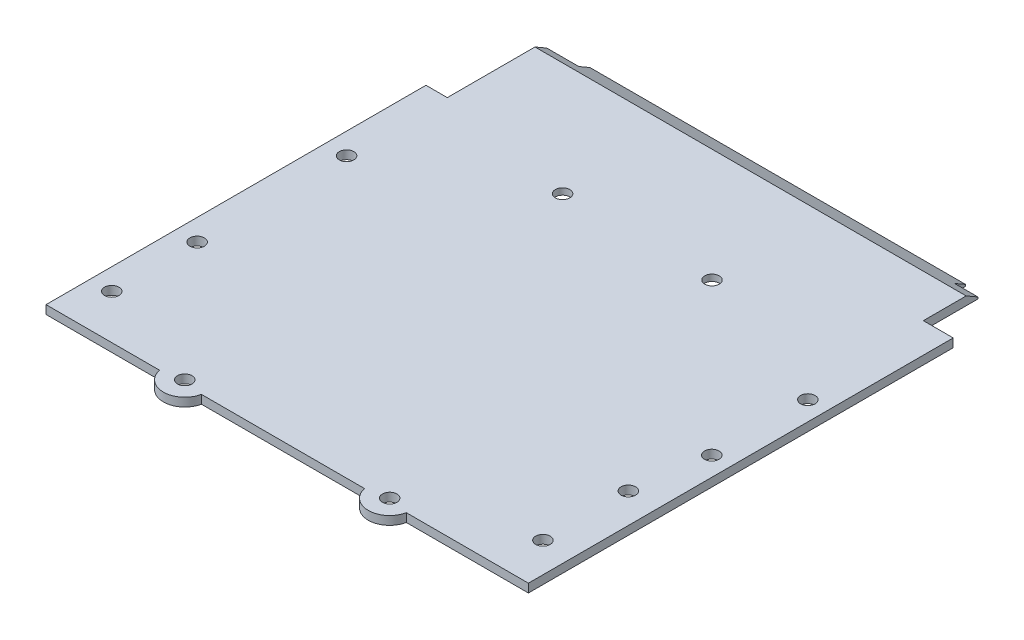
from build123d import *

# Parameters (mm, degrees)
SKETCH_1_W           = 113
SKETCH_1_H           = 113
EXTRUDE_1_DEPTH      = 3
CUT_EXTRUDE_1_REACH  = 161.834
SKETCH_2_R           = 1.7
SKETCH_3_W           = 90
SKETCH_3_H           = 105
EXTRUDE_2_DEPTH      = 1.5
SKETCH_5_R           = 5
EXTRUDE_3_DEPTH      = 3
CUT_EXTRUDE_2_REACH  = 161.834
SKETCH_6_R           = 1.7
CUT_EXTRUDE_3_REACH  = 161.834
SKETCH_7_R           = 1.7
CUT_EXTRUDE_4_REACH  = 161.869
SKETCH_8_R           = 1.7
EXTRUDE_5_DEPTH      = 90
CUT_EXTRUDE_5_DEPTH  = 2
SKETCH_13_W          = 2
SKETCH_13_H          = 12
EXTRUDE_6_DEPTH      = 11.5
CUT_EXTRUDE_6_REACH  = 161.985
SKETCH_14_R          = 1.7
CUT_EXTRUDE_7_REACH  = 164.062
EXTRUDE_7_DEPTH      = 8.5
SKETCH_17_W          = 2
SKETCH_17_H          = 11.5
EXTRUDE_8_DEPTH      = 3
FILLET_1_R           = 1
CUT_EXTRUDE_8_DEPTH  = 163.062226394
SKETCH_20_W          = 113
SKETCH_20_H          = 12.124355653
CUT_EXTRUDE_9_DEPTH  = 1
CHAMFER_1_SIZE       = 1
SKETCH_21_W          = 7
SKETCH_21_H          = 13.5
CUT_EXTRUDE_10_DEPTH = 163.062226394
SKETCH_22_W          = 5
SKETCH_22_H          = 24
CUT_EXTRUDE_11_DEPTH = 163.062226394
SKETCH_23_W          = 2
SKETCH_23_H          = 18.598076211
CUT_EXTRUDE_12_DEPTH = 1.5
CHAMFER_2_SIZE       = 2
SKETCH_24_W          = 0.692820323
SKETCH_24_H          = 0.4
CUT_EXTRUDE_13_DEPTH = 95.5
SKETCH_25_W          = 0.692820323
SKETCH_25_H          = 0.4
CUT_EXTRUDE_14_DEPTH = 5.5
SKETCH_26_W          = 0.692820323
SKETCH_26_H          = 0.4
CUT_EXTRUDE_15_DEPTH = 7.5
SKETCH_27_W          = 113
SKETCH_27_H          = 105.875644347
CUT_EXTRUDE_16_DEPTH = 162.723430061
SKETCH_29_W          = 10
SKETCH_29_H          = 5
CUT_EXTRUDE_17_DEPTH = 162.605129345
SKETCH_30_W          = 10
SKETCH_30_H          = 2
CUT_EXTRUDE_18_DEPTH = 37
SKETCH_31_W          = 10
SKETCH_31_H          = 27
EXTRUDE_9_DEPTH      = 1
CUT_EXTRUDE_19_REACH = 163.569
SKETCH_32_W          = 5
SKETCH_32_H          = 12


with BuildPart() as part:
    # 草图1 → 凸台-拉伸1 (new body)
    with BuildSketch(Plane(origin=(0, 0, 0), x_dir=(1, 0, 0), z_dir=(0, 1, 0))):
        with Locations((56.5, 56.5)):
            Rectangle(SKETCH_1_W, SKETCH_1_H)
    extrude(amount=EXTRUDE_1_DEPTH)

    # 草图2 → 切除-拉伸1 (cut, up to next)
    with BuildSketch(Plane(origin=(0, 3, 0), x_dir=(1, 0, 0), z_dir=(0, 1, 0)), mode=Mode.PRIVATE) as cut_extrude_1_sk1:
        with Locations(Location((108.5, 69.95, 0), (0, 0, 270))):
            Circle(SKETCH_2_R)
    cut_extrude_1_tool1 = extrude(cut_extrude_1_sk1.sketch, amount=-CUT_EXTRUDE_1_REACH, mode=Mode.PRIVATE) & part.part
    # 草图2 → 切除-拉伸1 (cut, up to next)
    with BuildSketch(Plane(origin=(0, 3, 0), x_dir=(1, 0, 0), z_dir=(0, 1, 0)), mode=Mode.PRIVATE) as cut_extrude_1_sk2:
        with Locations(Location((108.5, 47.45, 0), (0, 0, 270))):
            Circle(SKETCH_2_R)
    cut_extrude_1_tool2 = extrude(cut_extrude_1_sk2.sketch, amount=-CUT_EXTRUDE_1_REACH, mode=Mode.PRIVATE) & part.part
    # 草图2 → 切除-拉伸1 (cut, up to next)
    with BuildSketch(Plane(origin=(0, 3, 0), x_dir=(1, 0, 0), z_dir=(0, 1, 0)), mode=Mode.PRIVATE) as cut_extrude_1_sk3:
        with Locations(Location((106, 30.4, 0), (0, 0, 270))):
            Circle(SKETCH_2_R)
    cut_extrude_1_tool3 = extrude(cut_extrude_1_sk3.sketch, amount=-CUT_EXTRUDE_1_REACH, mode=Mode.PRIVATE) & part.part
    # 草图2 → 切除-拉伸1 (cut, up to next)
    with BuildSketch(Plane(origin=(0, 3, 0), x_dir=(1, 0, 0), z_dir=(0, 1, 0)), mode=Mode.PRIVATE) as cut_extrude_1_sk4:
        with Locations(Location((106, 10.4, 0), (0, 0, 270))):
            Circle(SKETCH_2_R)
    cut_extrude_1_tool4 = extrude(cut_extrude_1_sk4.sketch, amount=-CUT_EXTRUDE_1_REACH, mode=Mode.PRIVATE) & part.part
    add(cut_extrude_1_tool1.solids().sort_by_distance((108.5, 3, -69.95))[0], mode=Mode.SUBTRACT)
    add(cut_extrude_1_tool2.solids().sort_by_distance((108.5, 3, -47.45))[0], mode=Mode.SUBTRACT)
    add(cut_extrude_1_tool3.solids().sort_by_distance((106, 3, -30.4))[0], mode=Mode.SUBTRACT)
    add(cut_extrude_1_tool4.solids().sort_by_distance((106, 3, -10.4))[0], mode=Mode.SUBTRACT)

    # 草图3 → 凸台-拉伸2 (add)
    with BuildSketch(Plane(origin=(0, 0, 0), x_dir=(1, 0, 0), z_dir=(0, 1, 0))):
        with Locations((55.5, 60.5)):
            Rectangle(SKETCH_3_W, SKETCH_3_H)
    extrude(amount=-EXTRUDE_2_DEPTH)

    # 草图5 → 凸台-拉伸3 (add)
    with BuildSketch(Plane.XZ):
        with Locations((79.5, -1)):
            Circle(SKETCH_5_R)
        with Locations((31.5, -1)):
            Circle(SKETCH_5_R)
    extrude(amount=-EXTRUDE_3_DEPTH)

    # 草图6 → 切除-拉伸2 (cut, up to next)
    with BuildSketch(Plane.XZ, mode=Mode.PRIVATE) as cut_extrude_2_sk1:
        with Locations(Location((31.5, -1, 0), (0, 0, 270))):
            Circle(SKETCH_6_R)
    cut_extrude_2_tool1 = extrude(cut_extrude_2_sk1.sketch, amount=-CUT_EXTRUDE_2_REACH, mode=Mode.PRIVATE) & part.part
    # 草图6 → 切除-拉伸2 (cut, up to next)
    with BuildSketch(Plane.XZ, mode=Mode.PRIVATE) as cut_extrude_2_sk2:
        with Locations(Location((79.5, -1, 0), (0, 0, 270))):
            Circle(SKETCH_6_R)
    cut_extrude_2_tool2 = extrude(cut_extrude_2_sk2.sketch, amount=-CUT_EXTRUDE_2_REACH, mode=Mode.PRIVATE) & part.part
    add(cut_extrude_2_tool1.solids().sort_by_distance((31.5, 0, -1))[0], mode=Mode.SUBTRACT)
    add(cut_extrude_2_tool2.solids().sort_by_distance((79.5, 0, -1))[0], mode=Mode.SUBTRACT)

    # 草图7 → 切除-拉伸3 (cut, up to next)
    with BuildSketch(Plane.XZ, mode=Mode.PRIVATE) as cut_extrude_3_sk1:
        with Locations(Location((5, -10.4, 0), (0, 0, 270))):
            Circle(SKETCH_7_R)
    cut_extrude_3_tool1 = extrude(cut_extrude_3_sk1.sketch, amount=-CUT_EXTRUDE_3_REACH, mode=Mode.PRIVATE) & part.part
    # 草图7 → 切除-拉伸3 (cut, up to next)
    with BuildSketch(Plane.XZ, mode=Mode.PRIVATE) as cut_extrude_3_sk2:
        with Locations(Location((5, -30.4, 0), (0, 0, 270))):
            Circle(SKETCH_7_R)
    cut_extrude_3_tool2 = extrude(cut_extrude_3_sk2.sketch, amount=-CUT_EXTRUDE_3_REACH, mode=Mode.PRIVATE) & part.part
    # 草图7 → 切除-拉伸3 (cut, up to next)
    with BuildSketch(Plane.XZ, mode=Mode.PRIVATE) as cut_extrude_3_sk3:
        with Locations(Location((5, -65.4, 0), (0, 0, 270))):
            Circle(SKETCH_7_R)
    cut_extrude_3_tool3 = extrude(cut_extrude_3_sk3.sketch, amount=-CUT_EXTRUDE_3_REACH, mode=Mode.PRIVATE) & part.part
    add(cut_extrude_3_tool1.solids().sort_by_distance((5, 0, -10.4))[0], mode=Mode.SUBTRACT)
    add(cut_extrude_3_tool2.solids().sort_by_distance((5, 0, -30.4))[0], mode=Mode.SUBTRACT)
    add(cut_extrude_3_tool3.solids().sort_by_distance((5, 0, -65.4))[0], mode=Mode.SUBTRACT)

    # 草图8 → 切除-拉伸4 (cut, up to next)
    with BuildSketch(Plane.XZ.offset(1.5), mode=Mode.PRIVATE) as cut_extrude_4_sk1:
        with Locations(Location((38, -83, 0), (0, 0, 270))):
            Circle(SKETCH_8_R)
    cut_extrude_4_tool1 = extrude(cut_extrude_4_sk1.sketch, amount=-CUT_EXTRUDE_4_REACH, mode=Mode.PRIVATE) & part.part
    # 草图8 → 切除-拉伸4 (cut, up to next)
    with BuildSketch(Plane.XZ.offset(1.5), mode=Mode.PRIVATE) as cut_extrude_4_sk2:
        with Locations(Location((73, -83, 0), (0, 0, 270))):
            Circle(SKETCH_8_R)
    cut_extrude_4_tool2 = extrude(cut_extrude_4_sk2.sketch, amount=-CUT_EXTRUDE_4_REACH, mode=Mode.PRIVATE) & part.part
    add(cut_extrude_4_tool1.solids().sort_by_distance((38, -1.5, -83))[0], mode=Mode.SUBTRACT)
    add(cut_extrude_4_tool2.solids().sort_by_distance((73, -1.5, -83))[0], mode=Mode.SUBTRACT)

    # 草图10 → 凸台-拉伸5 (add)
    with BuildSketch(Plane(origin=(100.5, 0, 0), x_dir=(0, 0, -1), z_dir=(1, 0, 0))):
        Polygon((113, 0), (115.598076211, -1.5), (113, -1.5), align=None)
    extrude(amount=-EXTRUDE_5_DEPTH)

    # 草图11 → 切除-拉伸5 (cut)
    with BuildSketch(Plane(origin=(0, -1.5, 0), x_dir=(1, 0, 0), z_dir=(0, 1, 0))):
        with BuildLine():
            Line((33, 83), (33, 53))
            ThreePointArc((33, 53), (38, 48), (43, 53))
            Line((43, 53), (43, 83))
            ThreePointArc((43, 83), (38, 88), (33, 83))
        make_face()
        with BuildLine():
            Line((68, 83), (68, 53))
            ThreePointArc((68, 53), (73, 48), (78, 53))
            Line((78, 53), (78, 83))
            ThreePointArc((78, 83), (73, 88), (68, 83))
        make_face()
    extrude(amount=CUT_EXTRUDE_5_DEPTH, mode=Mode.SUBTRACT)

    # 草图13 → 凸台-拉伸6 (add)
    with BuildSketch(Plane.XZ):
        with Locations((4, -83)):
            Rectangle(SKETCH_13_W, SKETCH_13_H)
    extrude(amount=EXTRUDE_6_DEPTH)

    # 草图14 → 切除-拉伸6 (cut, up to next)
    with BuildSketch(Plane.ZY.offset(-3), mode=Mode.PRIVATE) as cut_extrude_6_sk1:
        with Locations((-83.5, -5)):
            Circle(SKETCH_14_R)
    cut_extrude_6_tool1 = extrude(cut_extrude_6_sk1.sketch, amount=-CUT_EXTRUDE_6_REACH, mode=Mode.PRIVATE) & part.part
    add(cut_extrude_6_tool1.solids().sort_by_distance((3, -5, -83.5))[0], mode=Mode.SUBTRACT)

    # 草图15 → 切除-拉伸7 (cut, up to next)
    with BuildSketch(Plane.XZ, mode=Mode.PRIVATE) as cut_extrude_7_sk1:
        Polygon((113, -100.875644347), (106, -113), (113, -113), align=None)
    cut_extrude_7_tool1 = extrude(cut_extrude_7_sk1.sketch, amount=-CUT_EXTRUDE_7_REACH, mode=Mode.PRIVATE) & part.part
    add(cut_extrude_7_tool1.solids().sort_by_distance((110.666667, 0, -108.958548))[0], mode=Mode.SUBTRACT)

    # 草图16 → 凸台-拉伸7 (add)
    with BuildSketch(Plane.XZ):
        Polygon((113, -99.5), (107.5, -99.5), (107.5, -110.401923789), (113, -100.875644347), align=None)
    extrude(amount=EXTRUDE_7_DEPTH)

    # 草图17 → 凸台-拉伸8 (add)
    with BuildSketch(Plane.ZY.offset(-3)):
        with Locations((-78, -5.75)):
            Rectangle(SKETCH_17_W, SKETCH_17_H)
    extrude(amount=EXTRUDE_8_DEPTH)

    # 圆角1
    fillet_1_edges = [part.edges().sort_by_distance(p)[0] for p in [
        (3, -5.75, -79),
    ]]
    fillet(fillet_1_edges, radius=FILLET_1_R)

    # 草图19 → 切除-拉伸8 (cut, through all)
    with BuildSketch(Plane.ZY):
        Polygon((-113, 0), (-107.803847577, 3), (-113, 3), align=None)
    extrude(amount=-CUT_EXTRUDE_8_DEPTH, mode=Mode.SUBTRACT)

    # 草图20 → 切除-拉伸9 (cut)
    with BuildSketch(Plane(origin=(0, 3, 0), x_dir=(1, 0, 0), z_dir=(0, 1, 0))):
        with Locations((56.5, 106.937822173)):
            Rectangle(SKETCH_20_W, SKETCH_20_H)
    extrude(amount=-CUT_EXTRUDE_9_DEPTH, mode=Mode.SUBTRACT)

    # 倒角1
    chamfer_1_edges = [part.edges().sort_by_distance(p)[0] for p in [
        (56.5, 2, -100.875644347),
    ]]
    chamfer(chamfer_1_edges, length=CHAMFER_1_SIZE - 0.0001)  # a hair under: the kernel refuses the full size

    # 草图21 → 切除-拉伸10 (cut, through all)
    with BuildSketch(Plane.XZ.offset(8.5)):
        with Locations((109.5, -106.25)):
            Rectangle(SKETCH_21_W, SKETCH_21_H)
    extrude(amount=-CUT_EXTRUDE_10_DEPTH, mode=Mode.SUBTRACT)

    # 草图22 → 切除-拉伸11 (cut, through all)
    with BuildSketch(Plane.XZ):
        with Locations((2.5, -101)):
            Rectangle(SKETCH_22_W, SKETCH_22_H)
    extrude(amount=-CUT_EXTRUDE_11_DEPTH, mode=Mode.SUBTRACT)

    # 草图23 → 切除-拉伸12 (cut)
    with BuildSketch(Plane.XZ.offset(1.5)):
        with Locations((11.5, -106.299038106)):
            Rectangle(SKETCH_23_W, SKETCH_23_H)
    extrude(amount=-CUT_EXTRUDE_12_DEPTH, mode=Mode.SUBTRACT)

    # 倒角2
    chamfer_2_edges = [part.edges().sort_by_distance(p)[0] for p in [
        (10.5, -0.75, -97),
    ]]
    chamfer(chamfer_2_edges, length=CHAMFER_2_SIZE - 0.0001)  # a hair under: the kernel refuses the full size

    # 草图24 → 切除-拉伸13 (cut)
    with BuildSketch(Plane(origin=(100.5, 0, 0), x_dir=(0, 0, -1), z_dir=(1, 0, 0))):
        with Locations((115.25166605, -1.3)):
            Rectangle(SKETCH_24_W, SKETCH_24_H)
    extrude(amount=-CUT_EXTRUDE_13_DEPTH, mode=Mode.SUBTRACT)

    # 草图25 → 切除-拉伸14 (cut)
    with BuildSketch(Plane(origin=(106, 0, 0), x_dir=(0, 0, -1), z_dir=(1, 0, 0))):
        with Locations((112.653589839, 0.2)):
            Rectangle(SKETCH_25_W, SKETCH_25_H)
    extrude(amount=-CUT_EXTRUDE_14_DEPTH, mode=Mode.SUBTRACT)

    # 草图26 → 切除-拉伸15 (cut)
    with BuildSketch(Plane.ZY.offset(-5)):
        with Locations((-112.653589839, 0.2)):
            Rectangle(SKETCH_26_W, SKETCH_26_H)
    extrude(amount=-CUT_EXTRUDE_15_DEPTH, mode=Mode.SUBTRACT)

    # 草图27 → 切除-拉伸16 (cut, through all)
    with BuildSketch(Plane(origin=(0, 2, 0), x_dir=(1, 0, 0), z_dir=(0, 1, 0))):
        with Locations((56.5, 48.937822174)):
            Rectangle(SKETCH_27_W, SKETCH_27_H)
    extrude(amount=CUT_EXTRUDE_16_DEPTH, mode=Mode.SUBTRACT)

    # 草图29 → 切除-拉伸17 (cut, through all)
    with BuildSketch(Plane.XZ.offset(-0.5)):
        with Locations((38, -50.5)):
            Rectangle(SKETCH_29_W, SKETCH_29_H)
        with Locations((73, -50.5)):
            Rectangle(SKETCH_29_W, SKETCH_29_H)
    extrude(amount=CUT_EXTRUDE_17_DEPTH, mode=Mode.SUBTRACT)

    # 草图30 → 切除-拉伸18 (cut)
    with BuildSketch(Plane(origin=(0, 0, -48), x_dir=(-1, 0, 0), z_dir=(0, 0, -1))):
        with Locations((-38, -0.5)):
            Rectangle(SKETCH_30_W, SKETCH_30_H)
        with Locations((-73, -0.5)):
            Rectangle(SKETCH_30_W, SKETCH_30_H)
    extrude(amount=-CUT_EXTRUDE_18_DEPTH, mode=Mode.SUBTRACT)

    # 草图31 → 凸台-拉伸9 (add)
    with BuildSketch(Plane.XZ.offset(-0.5)):
        with Locations((38, -24.5)):
            Rectangle(SKETCH_31_W, SKETCH_31_H)
        with Locations((73, -24.5)):
            Rectangle(SKETCH_31_W, SKETCH_31_H)
    extrude(amount=EXTRUDE_9_DEPTH)

    # 草图32 → 切除-拉伸19 (cut, up to next)
    with BuildSketch(Plane.XZ, mode=Mode.PRIVATE) as cut_extrude_19_sk1:
        with Locations((2.5, -83)):
            Rectangle(SKETCH_32_W, SKETCH_32_H)
    cut_extrude_19_tool1 = extrude(cut_extrude_19_sk1.sketch, amount=CUT_EXTRUDE_19_REACH, mode=Mode.PRIVATE) & part.part
    add(cut_extrude_19_tool1.solids().sort_by_distance((2.5, 0, -83))[0], mode=Mode.SUBTRACT)


solid = part.part
